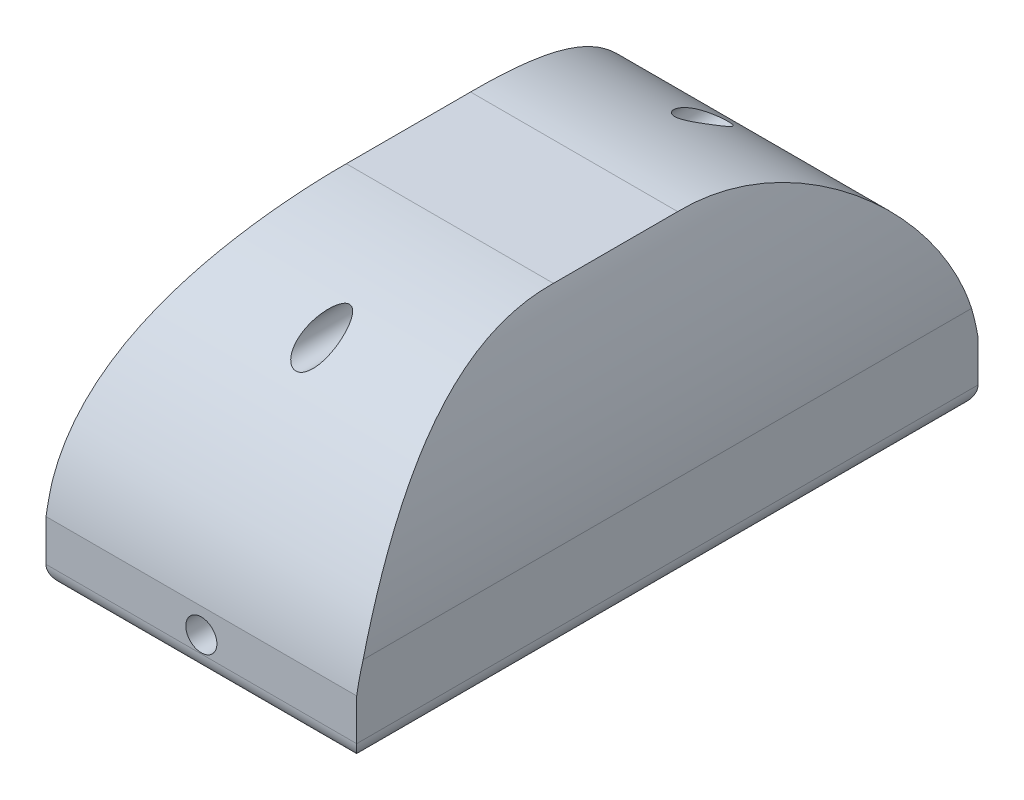
from build123d import *

# Parameters (mm, degrees)
BOSS_EXTRUDE1_DEPTH = 15
CUT_EXTRUDE1_START  = -52.852812827
CUT_EXTRUDE1_DEPTH  = 29.377193365
SKETCH4_R           = 0.75
CUT_EXTRUDE2_DEPTH  = 37.562677601
FILLET1_R           = 1


# Read off the part's stored shape, not the designer's step: Cut-Extrude1
with BuildPart() as part:
    # Sketch2 → Boss-Extrude1 (new body)
    with BuildSketch(Plane(origin=(0, 0, 0), x_dir=(0, 0, -1), z_dir=(1, 0, 0))):
        with BuildLine():
            Line((23.164216144, -14.554359634), (53.164216144, -14.554359634))
            Line((53.164216144, -14.554359634), (53.164216144, -11.554359634))
            ThreePointArc((53.164216144, -11.554359634), (49.01383429, -4.334817859), (41.164216144, -1.554359634))
            Line((41.164216144, -1.554359634), (35.164216144, -1.554359634))
            ThreePointArc((35.164216144, -1.554359634), (27.314597998, -4.334817859), (23.164216144, -11.554359634))
            Line((23.164216144, -11.554359634), (23.164216144, -14.554359634))
        make_face()
    extrude(amount=BOSS_EXTRUDE1_DEPTH)

    # Cut-Extrude1 outline → Cut-Extrude1 (cut)
    with BuildSketch(Plane.XY.offset(CUT_EXTRUDE1_START)):
        with BuildLine():
            Line((2.5, -1.553202413), (0, -1.553202413))
            Line((0, -1.553202413), (0, -10.196848008))
            ThreePointArc((0, -10.196848008), (0.718019025, -5.721160452), (2.5, -1.553202413))
        make_face()
        with BuildLine():
            Line((15, -1.553202413), (12.5, -1.553202413))
            ThreePointArc((12.5, -1.553202413), (14.281980975, -5.721160452), (15, -10.196848008))
            Line((15, -10.196848008), (15, -1.553202413))
        make_face()
    extrude(amount=CUT_EXTRUDE1_DEPTH, mode=Mode.SUBTRACT)

    # Sketch4 → Cut-Extrude2 (cut, through all)
    with BuildSketch(Plane.XY.offset(-23.164216144)):
        with Locations((7.5, -12.754359634)):
            Circle(SKETCH4_R)
        with Locations((7.5, -3.254359634)):
            Circle(SKETCH4_R)
    extrude(amount=-CUT_EXTRUDE2_DEPTH, mode=Mode.SUBTRACT)

    # Fillet1
    fillet1_edges = [part.edges().sort_by_distance(p)[0] for p in [
        (7.5, -14.554359634, -53.164216144),
        (7.5, -14.554359634, -23.164216144),
        (0, -14.554359634, -38.164216144),
        (15, -14.554359634, -38.164216144),
    ]]
    fillet(fillet1_edges, radius=FILLET1_R)


solid = part.part
